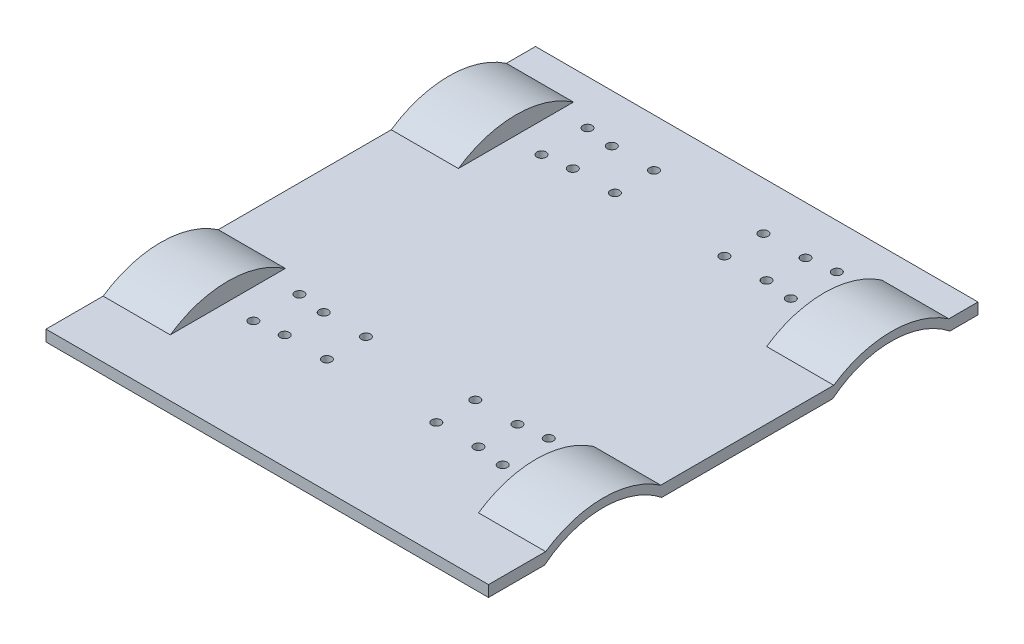
from build123d import *

# Parameters (mm, degrees)
BOSS_EXTRUDE1_START = 26.668379
BOSS_EXTRUDE1_DEPTH = 22
BOSS_EXTRUDE2_START = 24.668379
BOSS_EXTRUDE2_DEPTH = 2
BOSS_EXTRUDE3_START = -30.431621
BOSS_EXTRUDE3_DEPTH = 55.1
SKETCH3_R           = 1.65
CUT_EXTRUDE3_DEPTH  = 242.205815579
MIRROR5_START       = 95.008684799
MIRROR5_OUTLINE_R   = 1.65
MIRROR5_DEPTH       = 10.349567393
MIRROR5_START_2     = -81.71192711
MIRROR5_2_OUTLINE_W = 6.349567393
MIRROR5_2_OUTLINE_H = 175.000000001
MIRROR5_2_DEPTH     = 55.1
MIRROR5_START_3     = -105.71192711
MIRROR5_3_DEPTH     = 22
MIRROR5_START_4     = -83.71192711
MIRROR5_4_DEPTH     = 2


with BuildPart() as part:
    # Sketch1 → Boss-Extrude1 (new body)
    with BuildSketch(Plane(origin=(3.819694134, 12.849567393, 0), x_dir=(2.970776402655419e-12, 0, -1.0), z_dir=(1.0, 0, 2.970776402655419e-12)).offset(BOSS_EXTRUDE1_START)):
        with BuildLine():
            Line((60.340031958, 86.159117405), (60.340031958, 82.159117405))
            Line((60.340031958, 82.159117405), (75.876236591, 82.159117405))
            ThreePointArc((75.876236591, 82.159117405), (78.235478607, 84.265181653), (80.768172206, 86.159117405))
            Line((80.768172206, 86.159117405), (60.340031958, 86.159117405))
        make_face()
        with BuildLine():
            ThreePointArc((80.768172206, 86.159117405), (78.235478607, 84.265181653), (75.876236591, 82.159117405))
            Line((75.876236591, 82.159117405), (80.40191183, 82.159117405))
            ThreePointArc((80.40191183, 82.159117405), (83.458066287, 84.336856356), (86.738613751, 86.159117405))
            Line((86.738613751, 86.159117405), (80.768172206, 86.159117405))
        make_face()
        with BuildLine():
            ThreePointArc((115.941450164, 86.159117405), (119.221997628, 84.336856356), (122.278152085, 82.159117405))
            Line((122.278152085, 82.159117405), (126.803827325, 82.159117405))
            ThreePointArc((126.803827325, 82.159117405), (124.444585309, 84.265181653), (121.911891709, 86.159117405))
            Line((121.911891709, 86.159117405), (115.941450164, 86.159117405))
        make_face()
        with BuildLine():
            ThreePointArc((121.911891709, 86.159117405), (101.340031958, 92.508684799), (80.768172206, 86.159117405))
            Line((80.768172206, 86.159117405), (86.738613751, 86.159117405))
            ThreePointArc((86.738613751, 86.159117405), (101.340031958, 89.508684799), (115.941450164, 86.159117405))
            Line((115.941450164, 86.159117405), (121.911891709, 86.159117405))
        make_face()
        with BuildLine():
            Line((183.768172206, 86.159117405), (121.911891709, 86.159117405))
            ThreePointArc((121.911891709, 86.159117405), (124.444585309, 84.265181653), (126.803827325, 82.159117405))
            Line((126.803827325, 82.159117405), (178.876236591, 82.159117405))
            ThreePointArc((178.876236591, 82.159117405), (181.235478607, 84.265181653), (183.768172206, 86.159117405))
        make_face()
        with BuildLine():
            Line((189.738613751, 86.159117405), (183.768172206, 86.159117405))
            ThreePointArc((183.768172206, 86.159117405), (181.235478607, 84.265181653), (178.876236591, 82.159117405))
            Line((178.876236591, 82.159117405), (183.40191183, 82.159117405))
            ThreePointArc((183.40191183, 82.159117405), (186.458066287, 84.336856356), (189.738613751, 86.159117405))
        make_face()
        with BuildLine():
            ThreePointArc((229.803827325, 82.159117405), (227.444585309, 84.265181653), (224.911891709, 86.159117405))
            Line((224.911891709, 86.159117405), (218.941450164, 86.159117405))
            ThreePointArc((218.941450164, 86.159117405), (222.221997628, 84.336856356), (225.278152085, 82.159117405))
            Line((225.278152085, 82.159117405), (229.803827325, 82.159117405))
        make_face()
        with BuildLine():
            ThreePointArc((224.911891709, 86.159117405), (204.340031958, 92.508684799), (183.768172206, 86.159117405))
            Line((183.768172206, 86.159117405), (189.738613751, 86.159117405))
            ThreePointArc((189.738613751, 86.159117405), (204.340031958, 89.508684799), (218.941450164, 86.159117405))
            Line((218.941450164, 86.159117405), (224.911891709, 86.159117405))
        make_face()
        with BuildLine():
            Line((235.340031958, 86.159117405), (224.911891709, 86.159117405))
            ThreePointArc((224.911891709, 86.159117405), (227.444585309, 84.265181653), (229.803827325, 82.159117405))
            Line((229.803827325, 82.159117405), (235.340031958, 82.159117405))
            Line((235.340031958, 82.159117405), (235.340031958, 86.159117405))
        make_face()
    extrude(amount=BOSS_EXTRUDE1_DEPTH)

    # Sketch1<7> → Boss-Extrude2 (add)
    with BuildSketch(Plane(origin=(3.819694134, 12.849567393, 0), x_dir=(2.970776402655419e-12, 0, -1.0), z_dir=(1.0, 0, 2.970776402655419e-12)).offset(BOSS_EXTRUDE2_START)):
        with BuildLine():
            ThreePointArc((121.911891709, 86.159117405), (101.340031958, 92.508684799), (80.768172206, 86.159117405))
            Line((80.768172206, 86.159117405), (86.738613751, 86.159117405))
            ThreePointArc((86.738613751, 86.159117405), (101.340031958, 89.508684799), (115.941450164, 86.159117405))
            Line((115.941450164, 86.159117405), (121.911891709, 86.159117405))
        make_face()
        with BuildLine():
            ThreePointArc((80.768172206, 86.159117405), (78.235478607, 84.265181653), (75.876236591, 82.159117405))
            Line((75.876236591, 82.159117405), (80.40191183, 82.159117405))
            ThreePointArc((80.40191183, 82.159117405), (83.458066287, 84.336856356), (86.738613751, 86.159117405))
            Line((86.738613751, 86.159117405), (80.768172206, 86.159117405))
        make_face()
        with BuildLine():
            ThreePointArc((115.941450164, 86.159117405), (119.221997628, 84.336856356), (122.278152085, 82.159117405))
            Line((122.278152085, 82.159117405), (126.803827325, 82.159117405))
            ThreePointArc((126.803827325, 82.159117405), (124.444585309, 84.265181653), (121.911891709, 86.159117405))
            Line((121.911891709, 86.159117405), (115.941450164, 86.159117405))
        make_face()
        with BuildLine():
            Line((60.340031958, 86.159117405), (60.340031958, 82.159117405))
            Line((60.340031958, 82.159117405), (75.876236591, 82.159117405))
            ThreePointArc((75.876236591, 82.159117405), (78.235478607, 84.265181653), (80.768172206, 86.159117405))
            Line((80.768172206, 86.159117405), (60.340031958, 86.159117405))
        make_face()
        with BuildLine():
            ThreePointArc((86.738613751, 86.159117405), (83.458066287, 84.336856356), (80.40191183, 82.159117405))
            Line((80.40191183, 82.159117405), (122.278152085, 82.159117405))
            ThreePointArc((122.278152085, 82.159117405), (119.221997628, 84.336856356), (115.941450164, 86.159117405))
            Line((115.941450164, 86.159117405), (86.738613751, 86.159117405))
        make_face()
        with BuildLine():
            ThreePointArc((115.941450164, 86.159117405), (101.340031958, 89.508684799), (86.738613751, 86.159117405))
            Line((86.738613751, 86.159117405), (115.941450164, 86.159117405))
        make_face()
        with BuildLine():
            Line((183.768172206, 86.159117405), (121.911891709, 86.159117405))
            ThreePointArc((121.911891709, 86.159117405), (124.444585309, 84.265181653), (126.803827325, 82.159117405))
            Line((126.803827325, 82.159117405), (178.876236591, 82.159117405))
            ThreePointArc((178.876236591, 82.159117405), (181.235478607, 84.265181653), (183.768172206, 86.159117405))
        make_face()
        with BuildLine():
            Line((189.738613751, 86.159117405), (183.768172206, 86.159117405))
            ThreePointArc((183.768172206, 86.159117405), (181.235478607, 84.265181653), (178.876236591, 82.159117405))
            Line((178.876236591, 82.159117405), (183.40191183, 82.159117405))
            ThreePointArc((183.40191183, 82.159117405), (186.458066287, 84.336856356), (189.738613751, 86.159117405))
        make_face()
        with BuildLine():
            ThreePointArc((229.803827325, 82.159117405), (227.444585309, 84.265181653), (224.911891709, 86.159117405))
            Line((224.911891709, 86.159117405), (218.941450164, 86.159117405))
            ThreePointArc((218.941450164, 86.159117405), (222.221997628, 84.336856356), (225.278152085, 82.159117405))
            Line((225.278152085, 82.159117405), (229.803827325, 82.159117405))
        make_face()
        with BuildLine():
            ThreePointArc((224.911891709, 86.159117405), (204.340031958, 92.508684799), (183.768172206, 86.159117405))
            Line((183.768172206, 86.159117405), (189.738613751, 86.159117405))
            ThreePointArc((189.738613751, 86.159117405), (204.340031958, 89.508684799), (218.941450164, 86.159117405))
            Line((218.941450164, 86.159117405), (224.911891709, 86.159117405))
        make_face()
        with BuildLine():
            ThreePointArc((218.941450164, 86.159117405), (204.340031958, 89.508684799), (189.738613751, 86.159117405))
            Line((189.738613751, 86.159117405), (218.941450164, 86.159117405))
        make_face()
        with BuildLine():
            Line((218.941450164, 86.159117405), (189.738613751, 86.159117405))
            ThreePointArc((189.738613751, 86.159117405), (186.458066287, 84.336856356), (183.40191183, 82.159117405))
            Line((183.40191183, 82.159117405), (225.278152085, 82.159117405))
            ThreePointArc((225.278152085, 82.159117405), (222.221997628, 84.336856356), (218.941450164, 86.159117405))
        make_face()
        with BuildLine():
            Line((235.340031958, 86.159117405), (224.911891709, 86.159117405))
            ThreePointArc((224.911891709, 86.159117405), (227.444585309, 84.265181653), (229.803827325, 82.159117405))
            Line((229.803827325, 82.159117405), (235.340031958, 82.159117405))
            Line((235.340031958, 82.159117405), (235.340031958, 86.159117405))
        make_face()
    extrude(amount=BOSS_EXTRUDE2_DEPTH)

    # Sketch1<12> → Boss-Extrude3 (add)
    with BuildSketch(Plane(origin=(3.819694134, 12.849567393, 0), x_dir=(2.970776402655419e-12, 0, -1.0), z_dir=(1.0, 0, 2.970776402655419e-12)).offset(BOSS_EXTRUDE3_START)):
        with BuildLine():
            Line((235.340031958, 86.159117405), (224.911891709, 86.159117405))
            ThreePointArc((224.911891709, 86.159117405), (227.444585309, 84.265181653), (229.803827325, 82.159117405))
            Line((229.803827325, 82.159117405), (235.340031958, 82.159117405))
            Line((235.340031958, 82.159117405), (235.340031958, 86.159117405))
        make_face()
        with BuildLine():
            Line((189.738613751, 86.159117405), (183.768172206, 86.159117405))
            ThreePointArc((183.768172206, 86.159117405), (181.235478607, 84.265181653), (178.876236591, 82.159117405))
            Line((178.876236591, 82.159117405), (183.40191183, 82.159117405))
            ThreePointArc((183.40191183, 82.159117405), (186.458066287, 84.336856356), (189.738613751, 86.159117405))
        make_face()
        with BuildLine():
            ThreePointArc((229.803827325, 82.159117405), (227.444585309, 84.265181653), (224.911891709, 86.159117405))
            Line((224.911891709, 86.159117405), (218.941450164, 86.159117405))
            ThreePointArc((218.941450164, 86.159117405), (222.221997628, 84.336856356), (225.278152085, 82.159117405))
            Line((225.278152085, 82.159117405), (229.803827325, 82.159117405))
        make_face()
        with BuildLine():
            Line((218.941450164, 86.159117405), (189.738613751, 86.159117405))
            ThreePointArc((189.738613751, 86.159117405), (186.458066287, 84.336856356), (183.40191183, 82.159117405))
            Line((183.40191183, 82.159117405), (225.278152085, 82.159117405))
            ThreePointArc((225.278152085, 82.159117405), (222.221997628, 84.336856356), (218.941450164, 86.159117405))
        make_face()
        with BuildLine():
            Line((183.768172206, 86.159117405), (121.911891709, 86.159117405))
            ThreePointArc((121.911891709, 86.159117405), (124.444585309, 84.265181653), (126.803827325, 82.159117405))
            Line((126.803827325, 82.159117405), (178.876236591, 82.159117405))
            ThreePointArc((178.876236591, 82.159117405), (181.235478607, 84.265181653), (183.768172206, 86.159117405))
        make_face()
        with BuildLine():
            ThreePointArc((80.768172206, 86.159117405), (78.235478607, 84.265181653), (75.876236591, 82.159117405))
            Line((75.876236591, 82.159117405), (80.40191183, 82.159117405))
            ThreePointArc((80.40191183, 82.159117405), (83.458066287, 84.336856356), (86.738613751, 86.159117405))
            Line((86.738613751, 86.159117405), (80.768172206, 86.159117405))
        make_face()
        with BuildLine():
            ThreePointArc((115.941450164, 86.159117405), (119.221997628, 84.336856356), (122.278152085, 82.159117405))
            Line((122.278152085, 82.159117405), (126.803827325, 82.159117405))
            ThreePointArc((126.803827325, 82.159117405), (124.444585309, 84.265181653), (121.911891709, 86.159117405))
            Line((121.911891709, 86.159117405), (115.941450164, 86.159117405))
        make_face()
        with BuildLine():
            ThreePointArc((86.738613751, 86.159117405), (83.458066287, 84.336856356), (80.40191183, 82.159117405))
            Line((80.40191183, 82.159117405), (122.278152085, 82.159117405))
            ThreePointArc((122.278152085, 82.159117405), (119.221997628, 84.336856356), (115.941450164, 86.159117405))
            Line((115.941450164, 86.159117405), (86.738613751, 86.159117405))
        make_face()
        with BuildLine():
            Line((60.340031958, 86.159117405), (60.340031958, 82.159117405))
            Line((60.340031958, 82.159117405), (75.876236591, 82.159117405))
            ThreePointArc((75.876236591, 82.159117405), (78.235478607, 84.265181653), (80.768172206, 86.159117405))
            Line((80.768172206, 86.159117405), (60.340031958, 86.159117405))
        make_face()
    extrude(amount=BOSS_EXTRUDE3_DEPTH)

    # Sketch3 → Cut-Extrude3 (cut, through all)
    with BuildSketch(Plane(origin=(0, 99.008684799, 0), x_dir=(1.0, 0, -7.801794756506578e-11), z_dir=(0, 1, 0))):
        with Locations(Location((17.95990954, 99.949578522, 0), (0, 0, 269.999999996))):
            Circle(SKETCH3_R)
        with Locations(Location((8.016236256, 101.199578523, 0), (0, 0, 269.999999996))):
            Circle(SKETCH3_R)
        with Locations(Location((-7.04009046, 101.199578524, 0), (0, 0, 269.999999996))):
            Circle(SKETCH3_R)
        with Locations(Location((-7.040090459, 115.155469507, 0), (0, 0, 269.999999996))):
            Circle(SKETCH3_R)
        with Locations(Location((8.016236257, 115.155469505, 0), (0, 0, 269.999999996))):
            Circle(SKETCH3_R)
        with Locations(Location((17.959909542, 116.405469505, 0), (0, 0, 269.999999996))):
            Circle(SKETCH3_R)
        with Locations(Location((17.95990954, 202.949578525, 0), (0, 0, 269.999999996))):
            Circle(SKETCH3_R)
        with Locations(Location((8.016236256, 204.199578526, 0), (0, 0, 269.999999996))):
            Circle(SKETCH3_R)
        with Locations(Location((-7.04009046, 204.199578528, 0), (0, 0, 269.999999996))):
            Circle(SKETCH3_R)
        with Locations(Location((-7.040090459, 218.15546951, 0), (0, 0, 269.999999996))):
            Circle(SKETCH3_R)
        with Locations(Location((8.016236257, 218.155469509, 0), (0, 0, 269.999999996))):
            Circle(SKETCH3_R)
        with Locations(Location((17.959909542, 219.405469508, 0), (0, 0, 269.999999996))):
            Circle(SKETCH3_R)
    extrude(amount=-CUT_EXTRUDE3_DEPTH, mode=Mode.SUBTRACT)

    # Mirror5: read off the stored shape, not the designer's step
    # Mirror5 outline → Mirror5 (add)
    with BuildSketch(Plane(origin=(0, 0, 0), x_dir=(1, 0, 0), z_dir=(0, 1, 0)).offset(MIRROR5_START)):
        Polygon((-105.711927111, 235.340031957), (-105.71192711, 60.340031957), (-26.61192711, 60.340031957), (-26.61192711, 235.340031958), align=None)
        with Locations((-71.183763752, 99.949578523)):
            Circle(MIRROR5_OUTLINE_R, mode=Mode.SUBTRACT)
        with Locations((-71.183763752, 116.405469506)):
            Circle(MIRROR5_OUTLINE_R, mode=Mode.SUBTRACT)
        with Locations((-61.240090468, 101.199578523)):
            Circle(MIRROR5_OUTLINE_R, mode=Mode.SUBTRACT)
        with Locations((-46.183763752, 101.199578523)):
            Circle(MIRROR5_OUTLINE_R, mode=Mode.SUBTRACT)
        with Locations((-61.240090468, 115.155469506)):
            Circle(MIRROR5_OUTLINE_R, mode=Mode.SUBTRACT)
        with Locations((-46.183763752, 115.155469506)):
            Circle(MIRROR5_OUTLINE_R, mode=Mode.SUBTRACT)
        with Locations((-71.183763744, 202.949578527)):
            Circle(MIRROR5_OUTLINE_R, mode=Mode.SUBTRACT)
        with Locations((-71.183763744, 219.40546951)):
            Circle(MIRROR5_OUTLINE_R, mode=Mode.SUBTRACT)
        with Locations((-61.24009046, 204.199578527)):
            Circle(MIRROR5_OUTLINE_R, mode=Mode.SUBTRACT)
        with Locations((-61.24009046, 218.15546951)):
            Circle(MIRROR5_OUTLINE_R, mode=Mode.SUBTRACT)
        with Locations((-46.183763744, 204.199578527)):
            Circle(MIRROR5_OUTLINE_R, mode=Mode.SUBTRACT)
        with Locations((-46.183763744, 218.15546951)):
            Circle(MIRROR5_OUTLINE_R, mode=Mode.SUBTRACT)
    extrude(amount=MIRROR5_DEPTH)

    # Mirror5 2 outline → Mirror5 2 (cut)
    with BuildSketch(Plane.YZ.offset(MIRROR5_START_2)):
        with Locations((102.183468496, -147.840031958)):
            Rectangle(MIRROR5_2_OUTLINE_W, MIRROR5_2_OUTLINE_H)
    extrude(amount=MIRROR5_2_DEPTH, mode=Mode.SUBTRACT)

    # Mirror5 3 outline → Mirror5 3 (cut)
    with BuildSketch(Plane.YZ.offset(MIRROR5_START_3)):
        with BuildLine():
            Line((99.008684799, -224.911891709), (99.008684799, -235.340031957))
            Line((99.008684799, -235.340031957), (105.358252192, -235.340031958))
            Line((105.358252192, -235.340031958), (105.358252192, -204.340031958))
            ThreePointArc((105.358252192, -204.340031958), (103.73475424, -215.10477092), (99.008684799, -224.911891709))
        make_face()
        with BuildLine():
            ThreePointArc((95.008684799, -225.278152085), (102.358252192, -204.340031958), (95.008684799, -183.40191183))
            Line((95.008684799, -183.40191183), (95.008684799, -225.278152085))
        make_face()
        with BuildLine():
            ThreePointArc((99.008684799, -183.768172206), (103.73475424, -193.575292995), (105.358252192, -204.340031958))
            Line((105.358252192, -204.340031958), (105.358252192, -101.340031957))
            ThreePointArc((105.358252192, -101.340031957), (103.73475424, -112.10477092), (99.008684799, -121.911891709))
            Line((99.008684799, -121.911891709), (99.008684799, -183.768172206))
        make_face()
        with BuildLine():
            ThreePointArc((99.008684799, -80.768172206), (103.73475424, -90.575292995), (105.358252192, -101.340031957))
            Line((105.358252192, -101.340031957), (105.358252192, -60.340031957))
            Line((105.358252192, -60.340031957), (99.008684799, -60.340031957))
            Line((99.008684799, -60.340031957), (99.008684799, -80.768172206))
        make_face()
        with BuildLine():
            Line((95.008684799, -80.40191183), (95.008684799, -122.278152085))
            ThreePointArc((95.008684799, -122.278152085), (102.358252192, -101.340031958), (95.008684799, -80.40191183))
        make_face()
    extrude(amount=MIRROR5_3_DEPTH, mode=Mode.SUBTRACT)

    # Mirror5 4 outline → Mirror5 4 (cut)
    with BuildSketch(Plane.YZ.offset(MIRROR5_START_4)):
        with BuildLine():
            Line((99.008684799, -224.911891709), (99.008684799, -235.340031957))
            Line((99.008684799, -235.340031957), (105.358252192, -235.340031958))
            Line((105.358252192, -235.340031958), (105.358252192, -204.340031958))
            ThreePointArc((105.358252192, -204.340031958), (103.73475424, -215.10477092), (99.008684799, -224.911891709))
        make_face()
        with BuildLine():
            ThreePointArc((99.008684799, -183.768172206), (103.73475424, -193.575292995), (105.358252192, -204.340031958))
            Line((105.358252192, -204.340031958), (105.358252192, -101.340031957))
            ThreePointArc((105.358252192, -101.340031957), (103.73475424, -112.10477092), (99.008684799, -121.911891709))
            Line((99.008684799, -121.911891709), (99.008684799, -183.768172206))
        make_face()
        with BuildLine():
            ThreePointArc((99.008684799, -80.768172206), (103.73475424, -90.575292995), (105.358252192, -101.340031957))
            Line((105.358252192, -101.340031957), (105.358252192, -60.340031957))
            Line((105.358252192, -60.340031957), (99.008684799, -60.340031957))
            Line((99.008684799, -60.340031957), (99.008684799, -80.768172206))
        make_face()
    extrude(amount=MIRROR5_4_DEPTH, mode=Mode.SUBTRACT)


solid = part.part
